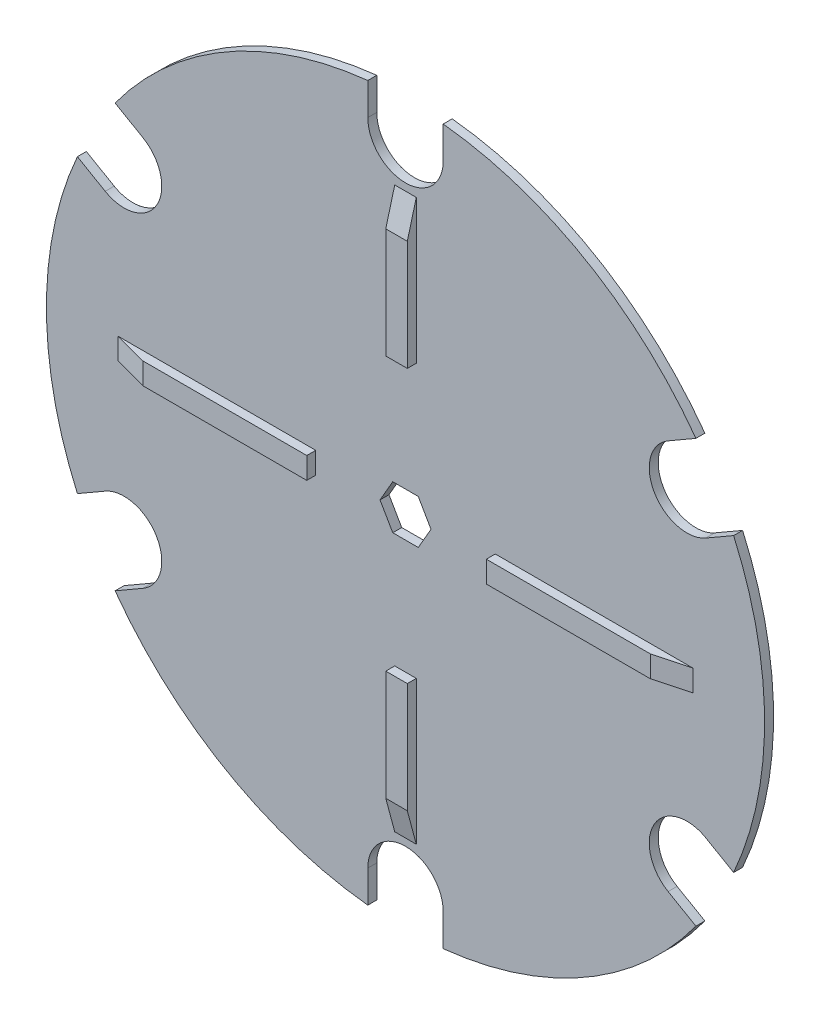
from build123d import *
from OCP.BRepFilletAPI import BRepFilletAPI_MakeChamfer

# Parameters (mm, degrees)
SKETCH1_R           = 100
BOSS_EXTRUDE1_DEPTH = 2.5
SKETCH8_W           = 1.221153846
SKETCH8_H           = 0.325641026
CUT_EXTRUDE6_DEPTH  = 0.2
CUT_EXTRUDE7_DEPTH  = 10
CUT_EXTRUDE8_DEPTH  = 10
BOSS_EXTRUDE2_DEPTH = 2.5
CHAMFER1_SIZE       = 2.5
CHAMFER1_SIZE_2     = 9.330127019


with BuildPart() as part:
    # Sketch1 → Boss-Extrude1 (new body)
    with BuildSketch(Plane.XY):
        Circle(SKETCH1_R)
    extrude(amount=BOSS_EXTRUDE1_DEPTH)

    # Sketch8 → Cut-Extrude6 (cut)
    # profile 1 of 12: a face of its own
    with BuildSketch(Plane(origin=(0, 0, 0), x_dir=(-1, 0, 0), z_dir=(0, 0, -1))):
        with BuildLine():
            add(Edge.make_bspline(
                [(-21.303796635, -42.5044388), (-21.303499075, -42.453550456), (-21.302921062, -42.354699113), (-21.296490852, -42.210658759), (-21.285808934, -42.075530497), (-21.271170032, -41.949307858), (-21.253355578, -41.831958258), (-21.229574387, -41.723795299), (-21.202529916, -41.62431837), (-21.171185911, -41.533203084), (-21.135818417, -41.449221882), (-21.09732448, -41.370821878), (-21.054176417, -41.298121696), (-21.008840217, -41.229960986), (-20.959480695, -41.167455492), (-20.907502507, -41.109722505), (-20.850876948, -41.058096324), (-20.791528933, -41.011064321), (-20.72892114, -40.969835158), (-20.66483815, -40.933519745), (-20.598838876, -40.902495579), (-20.530743124, -40.878102113), (-20.461162947, -40.857953702), (-20.389855107, -40.844175156), (-20.31670187, -40.835505675), (-20.267324783, -40.834676848), (-20.242283213, -40.834256508)],
                knots=[0, 0, 0, 0, 1.646270934, 3.197905019, 4.663502075, 6.030701355, 7.308322542, 8.50163776, 9.611534131, 10.641858119, 11.616356847, 12.558055219, 13.465016945, 14.349605745, 15.204443733, 16.039544428, 16.859896111, 17.680448484, 18.487036065, 19.28249412, 20.06191084, 20.843045899, 21.620316918, 22.403196591, 23.190181807, 24, 24, 24, 24], degree=3))
            add(Edge.make_bspline(
                [(-20.242283213, -40.834256508), (-20.217032458, -40.834699027), (-20.16681665, -40.835579056), (-20.092575738, -40.844037204), (-20.020049955, -40.858071722), (-19.949548501, -40.877957178), (-19.880492263, -40.902627542), (-19.813421379, -40.933549427), (-19.747919241, -40.969543828), (-19.685026766, -41.011838345), (-19.624053507, -41.058993695), (-19.566497141, -41.112299831), (-19.512352427, -41.171218505), (-19.460939829, -41.235119338), (-19.413717966, -41.305227951), (-19.368747781, -41.380324965), (-19.328496005, -41.461723678), (-19.28972955, -41.548065959), (-19.256267783, -41.64174085), (-19.226090547, -41.742220311), (-19.201707482, -41.850691181), (-19.181397214, -41.966584346), (-19.165662915, -42.09032542), (-19.154203304, -42.221649149), (-19.148149863, -42.360641932), (-19.147009855, -42.455672267), (-19.14642484, -42.5044388)],
                knots=[0, 0, 0, 0, 0.810914788, 1.612654377, 2.396697861, 3.181598691, 3.963628158, 4.749916497, 5.551656086, 6.361998678, 7.18212741, 8.025565596, 8.878627764, 9.750805457, 10.657531673, 11.591944965, 12.560506719, 13.57287815, 14.630710178, 15.753379473, 16.941251878, 18.199788006, 19.531962791, 20.947069417, 22.433333509, 24, 24, 24, 24], degree=3))
            add(Edge.make_bspline(
                [(-19.14642484, -42.5044388), (-19.14701592, -42.552992631), (-19.148167616, -42.64759779), (-19.154135443, -42.785965175), (-19.165890773, -42.916591971), (-19.180595548, -43.039791462), (-19.200961778, -43.155050874), (-19.226003608, -43.262769052), (-19.253807829, -43.363411174), (-19.288129392, -43.456152753), (-19.325694822, -43.54228753), (-19.366566322, -43.622721301), (-19.41035395, -43.698165009), (-19.458059454, -43.768014779), (-19.508907908, -43.832765418), (-19.563987616, -43.891273976), (-19.621745933, -43.944950228), (-19.682898624, -43.992712776), (-19.74677196, -44.034518277), (-19.812049122, -44.071905127), (-19.879888334, -44.102051929), (-19.948752227, -44.127937288), (-20.019625817, -44.147713412), (-20.092420757, -44.161387553), (-20.166766771, -44.170977729), (-20.217023905, -44.171709322), (-20.242283213, -44.172077021)],
                knots=[0, 0, 0, 0, 1.561518951, 3.042555995, 4.452378317, 5.7783523, 7.031515105, 8.214008947, 9.334062868, 10.386615937, 11.391082383, 12.354592575, 13.286541444, 14.194233754, 15.072674879, 15.931287219, 16.775624067, 17.606195743, 18.42308326, 19.229000347, 20.022332153, 20.807536673, 21.593273796, 22.3848459, 23.188221202, 24, 24, 24, 24], degree=3))
            add(Edge.make_bspline(
                [(-20.242283213, -44.172077021), (-20.267324088, -44.17165397), (-20.316699806, -44.170819796), (-20.389863077, -44.162189483), (-20.460876437, -44.148314276), (-20.530090306, -44.128886357), (-20.597859788, -44.105105755), (-20.663261419, -44.074123485), (-20.72702239, -44.038441865), (-20.788972587, -43.997806019), (-20.847947904, -43.951249921), (-20.904280211, -43.899756602), (-20.956554335, -43.842041078), (-21.005208122, -43.779014677), (-21.051448902, -43.711257236), (-21.093984262, -43.63784364), (-21.133327822, -43.559064986), (-21.169290132, -43.47441231), (-21.201174991, -43.38265034), (-21.229339697, -43.282729299), (-21.25157754, -43.173767258), (-21.270612078, -43.056639361), (-21.285964912, -42.930842295), (-21.296446335, -42.796307768), (-21.302924528, -42.653119614), (-21.303500628, -42.554903462), (-21.303796635, -42.5044388)],
                knots=[0, 0, 0, 0, 0.810891512, 1.598919785, 2.382837074, 3.152667961, 3.926044502, 4.706494248, 5.493654104, 6.291793342, 7.103789334, 7.925228297, 8.761435821, 9.622817696, 10.50288917, 11.416980706, 12.369136599, 13.353924996, 14.394355917, 15.514179734, 16.714354668, 17.994756427, 19.357759367, 20.818452758, 22.365282078, 24, 24, 24, 24], degree=3))
        make_face()
        with BuildLine():
            add(Edge.make_bspline(
                [(-21.018860737, -42.503166765), (-21.018752382, -42.545574513), (-21.018542085, -42.627879625), (-21.013048246, -42.747480298), (-21.005564107, -42.859031953), (-20.99591093, -42.962676233), (-20.981575398, -43.058062315), (-20.965512812, -43.145846242), (-20.945965617, -43.22556345), (-20.922837993, -43.297760964), (-20.896495384, -43.363664048), (-20.867733636, -43.424988007), (-20.836835695, -43.482457264), (-20.802256179, -43.535555608), (-20.764596086, -43.5844562), (-20.724706058, -43.630024555), (-20.681097357, -43.670661817), (-20.620768962, -43.71939975), (-20.541125017, -43.769763535), (-20.440776462, -43.813620345), (-20.337662938, -43.841181574), (-20.267675733, -43.844686552), (-20.232742949, -43.846435996)],
                knots=[0, 0, 0, 0, 1.459021318, 2.831673884, 4.118529203, 5.306027144, 6.411944654, 7.436330062, 8.375795394, 9.233974572, 10.042671642, 10.816086306, 11.563610507, 12.285937304, 12.993564865, 13.685989202, 14.367179055, 15.041617293, 16.353048772, 17.594441528, 18.799311195, 20, 20, 20, 20], degree=3))
            add(Edge.make_bspline(
                [(-20.232742949, -43.846435996), (-20.197584204, -43.84498658), (-20.127339304, -43.842090742), (-20.024710789, -43.814151887), (-19.925079044, -43.771997376), (-19.846999499, -43.722152139), (-19.787597477, -43.674682869), (-19.745037065, -43.63421101), (-19.705973635, -43.588893901), (-19.668924038, -43.53999954), (-19.634943305, -43.486593787), (-19.604043173, -43.42893345), (-19.575846137, -43.36685841), (-19.559781502, -43.323524433), (-19.551568069, -43.301368888)],
                knots=[0, 0, 0, 0, 1.353760809, 2.704726607, 4.075137775, 5.516104923, 6.260822281, 7.007110065, 7.778089737, 8.566572457, 9.372053459, 10.217411131, 11.088608312, 12, 12, 12, 12], degree=3))
            add(Edge.make_bspline(
                [(-19.551568069, -43.301368888), (-19.541996108, -43.273039053), (-19.522560923, -43.215517338), (-19.497513099, -43.126287454), (-19.477786916, -43.032667804), (-19.460040148, -42.935217877), (-19.447927019, -42.833219005), (-19.438177217, -42.726986785), (-19.432434379, -42.616441121), (-19.431722498, -42.541334236), (-19.431360737, -42.503166765)],
                knots=[0, 0, 0, 0, 0.884706709, 1.796334032, 2.740027952, 3.714592787, 4.726048262, 5.777819803, 6.87074269, 8, 8, 8, 8], degree=3))
            add(Edge.make_bspline(
                [(-19.431360737, -42.503166765), (-19.431859838, -42.465005467), (-19.432836184, -42.39035381), (-19.436568159, -42.281026604), (-19.446205259, -42.177187992), (-19.456908745, -42.078390635), (-19.47269051, -41.985181431), (-19.48970652, -41.896780083), (-19.51256762, -41.814281768), (-19.536987702, -41.736394861), (-19.564937132, -41.664004268), (-19.595703548, -41.596772476), (-19.628561858, -41.534374904), (-19.66425089, -41.47698275), (-19.702346974, -41.424338943), (-19.743855608, -41.377498989), (-19.787130289, -41.335011168), (-19.847743022, -41.286512981), (-19.927094699, -41.237063086), (-20.025833251, -41.191555575), (-20.128585906, -41.165422338), (-20.198048968, -41.161737808), (-20.232742949, -41.159897534)],
                knots=[0, 0, 0, 0, 1.31362396, 2.569729283, 3.763502607, 4.902122613, 5.988968491, 7.01645872, 7.998833611, 8.933434873, 9.825090667, 10.667526885, 11.477055099, 12.250526234, 12.991942729, 13.710640831, 14.402115721, 15.076753259, 16.378508321, 17.609869233, 18.806226677, 20, 20, 20, 20], degree=3))
            add(Edge.make_bspline(
                [(-20.232742949, -41.159897534), (-20.267858986, -41.161740346), (-20.338155033, -41.165429328), (-20.441975678, -41.191458208), (-20.541493197, -41.236827113), (-20.620635038, -41.286676765), (-20.681290045, -41.334155091), (-20.724000774, -41.375327088), (-20.764047658, -41.420363333), (-20.800939072, -41.469713642), (-20.835491493, -41.522750082), (-20.867224269, -41.57988989), (-20.895814989, -41.641422628), (-20.922198819, -41.707296108), (-20.945396991, -41.779487394), (-20.964532229, -41.859106409), (-20.98220977, -41.946611125), (-20.994724049, -42.042513822), (-21.005849028, -42.146184061), (-21.012998536, -42.2580142), (-21.018560463, -42.377815459), (-21.018758641, -42.460546124), (-21.018860737, -42.503166765)],
                knots=[0, 0, 0, 0, 1.207732386, 2.417664972, 3.655092373, 4.956220595, 5.625982001, 6.301752483, 6.994047911, 7.697131622, 8.419323945, 9.170223765, 9.943494443, 10.752040957, 11.610060368, 12.549350801, 13.567764191, 14.679664412, 15.874934091, 17.154273443, 18.533957287, 20, 20, 20, 20], degree=3))
        make_face(mode=Mode.SUBTRACT)
    # profile 2 of 12: a face of its own
    with BuildSketch(Plane(origin=(0, 0, 0), x_dir=(-1, 0, 0), z_dir=(0, 0, -1))):
        with BuildLine():
            Line((-18.45443766, -41.892589842), (-18.739373558, -41.892589842))
            add(Edge.make_bspline(
                [(-18.739373558, -41.892589842), (-18.737516498, -41.854788394), (-18.733869281, -41.780547355), (-18.716789333, -41.672303526), (-18.692350108, -41.56883953), (-18.657795718, -41.470986108), (-18.614882166, -41.377878047), (-18.563419927, -41.289885176), (-18.502465505, -41.207343169), (-18.433335111, -41.131017218), (-18.358252131, -41.060997065), (-18.277238886, -41.000531237), (-18.19210804, -40.949443064), (-18.103117871, -40.906733652), (-18.00926436, -40.874675363), (-17.911399196, -40.85088859), (-17.809092408, -40.836577191), (-17.73938753, -40.835038871), (-17.703936859, -40.834256508)],
                knots=[0, 0, 0, 0, 1.10065271, 2.161652631, 3.183658789, 4.190468796, 5.17591951, 6.163126047, 7.15150782, 8.156236427, 9.156009102, 10.134482811, 11.092018607, 12.041330605, 13.001268258, 13.972401359, 14.968799086, 16, 16, 16, 16], degree=3))
            add(Edge.make_bspline(
                [(-17.703936859, -40.834256508), (-17.669122463, -40.835071537), (-17.600713419, -40.836673038), (-17.500871449, -40.850426258), (-17.405823475, -40.871966902), (-17.315755287, -40.902188744), (-17.231385499, -40.942814617), (-17.152080309, -40.99161667), (-17.076895574, -41.048058946), (-17.009216563, -41.114510619), (-16.947069948, -41.185451354), (-16.893455759, -41.261186809), (-16.84754239, -41.33940909), (-16.809272137, -41.420714673), (-16.781099783, -41.505869105), (-16.75971098, -41.593632639), (-16.747621111, -41.684913718), (-16.74576562, -41.746696093), (-16.744822276, -41.778106669)],
                knots=[0, 0, 0, 0, 1.111607364, 2.184268762, 3.212621178, 4.221274766, 5.211760367, 6.196651075, 7.1921475, 8.207485113, 9.220403448, 10.201281604, 11.166441695, 12.114753415, 13.065576456, 14.026450734, 14.996634279, 16, 16, 16, 16], degree=3))
            add(Edge.make_bspline(
                [(-16.744822276, -41.778106669), (-16.746358307, -41.822327919), (-16.749403415, -41.909994398), (-16.775451456, -42.038822167), (-16.816133648, -42.163639054), (-16.865116965, -42.264093606), (-16.914531253, -42.345041133), (-16.959060635, -42.411687744), (-17.011189428, -42.483447704), (-17.071676351, -42.560080718), (-17.139270171, -42.642187039), (-17.214583134, -42.729717067), (-17.298152292, -42.821766459), (-17.356806789, -42.88463654), (-17.38720008, -42.917214241)],
                knots=[0, 0, 0, 0, 1.184426356, 2.348067706, 3.509069118, 4.696110526, 5.333549288, 6.050745305, 6.844228056, 7.710549037, 8.667450064, 9.695053472, 10.805634456, 12, 12, 12, 12], degree=3))
            Line((-17.38720008, -42.917214241), (-18.181586098, -43.765025739))
            Line((-18.181586098, -43.765025739), (-16.704117148, -43.765025739))
            Line((-16.704117148, -43.765025739), (-16.704117148, -44.090666765))
            Line((-16.704117148, -44.090666765), (-18.861488943, -44.090666765))
            Line((-18.861488943, -44.090666765), (-17.630158814, -42.776654345))
            add(Edge.make_bspline(
                [(-17.630158814, -42.776654345), (-17.60017966, -42.745359453), (-17.54259584, -42.685248369), (-17.461150216, -42.597488684), (-17.387999134, -42.516073029), (-17.322669071, -42.441155231), (-17.266577248, -42.371639452), (-17.216800295, -42.309777114), (-17.176917223, -42.252849863), (-17.133632542, -42.186863734), (-17.091709859, -42.106298275), (-17.055685079, -42.007842714), (-17.033718752, -41.906490135), (-17.031083652, -41.837999001), (-17.029758173, -41.803547374)],
                knots=[0, 0, 0, 0, 1.329631726, 2.553950428, 3.673215718, 4.687767853, 5.603093632, 6.413772471, 7.123043292, 7.734684054, 8.834405432, 9.900288307, 10.943827018, 12, 12, 12, 12], degree=3))
            add(Edge.make_bspline(
                [(-17.029758173, -41.803547374), (-17.030334882, -41.781883534), (-17.031471465, -41.739188265), (-17.041502377, -41.676590184), (-17.056661193, -41.616206389), (-17.078382963, -41.557851141), (-17.107054791, -41.502111157), (-17.141955643, -41.448918586), (-17.182223772, -41.397493596), (-17.228806709, -41.349275961), (-17.279980016, -41.305115153), (-17.334040514, -41.265995447), (-17.391235966, -41.233302825), (-17.451325219, -41.206502653), (-17.514140752, -41.185479271), (-17.579804057, -41.170911846), (-17.6481337, -41.161765592), (-17.694791229, -41.160528093), (-17.718565265, -41.159897534)],
                knots=[0, 0, 0, 0, 0.991446411, 1.95395049, 2.89581595, 3.838931463, 4.798493298, 5.75982156, 6.748411868, 7.785213223, 8.824556874, 9.840280684, 10.836137867, 11.835679398, 12.848801643, 13.863922112, 14.911575587, 16, 16, 16, 16], degree=3))
            add(Edge.make_bspline(
                [(-17.718565265, -41.159897534), (-17.74339452, -41.160546171), (-17.792155078, -41.161819985), (-17.863745915, -41.170730545), (-17.93204087, -41.186102843), (-17.997211739, -41.207127398), (-18.059368792, -41.23385051), (-18.118209747, -41.267135164), (-18.17360251, -41.306853047), (-18.225651214, -41.351884123), (-18.273606395, -41.402019733), (-18.315740346, -41.457908771), (-18.352555845, -41.518530783), (-18.384677078, -41.583722197), (-18.410762597, -41.654074554), (-18.430695384, -41.729338115), (-18.446467737, -41.809186083), (-18.451736895, -41.864326838), (-18.45443766, -41.892589842)],
                knots=[0, 0, 0, 0, 1.031018746, 2.02475058, 2.990194455, 3.934040569, 4.864654155, 5.795059489, 6.735614925, 7.690564532, 8.649604399, 9.611025574, 10.590972636, 11.591080095, 12.624614302, 13.701020113, 14.821632451, 16, 16, 16, 16], degree=3))
        make_face()
    # profile 3 of 12: a face of its own
    with BuildSketch(Plane(origin=(0, 0, 0), x_dir=(-1, 0, 0), z_dir=(0, 0, -1))):
        with Locations((-15.808604327, -42.869512919)):
            Rectangle(SKETCH8_W, SKETCH8_H)
    # profile 4 of 12: a face of its own
    with BuildSketch(Plane(origin=(0, 0, 0), x_dir=(-1, 0, 0), z_dir=(0, 0, -1))):
        with BuildLine():
            add(Edge.make_bspline(
                [(-14.953796635, -42.5044388), (-14.953499075, -42.453550456), (-14.952921062, -42.354699113), (-14.946490852, -42.210658759), (-14.935808934, -42.075530497), (-14.921170032, -41.949307858), (-14.903355578, -41.831958258), (-14.879574387, -41.723795299), (-14.852529916, -41.62431837), (-14.821185911, -41.533203084), (-14.785818417, -41.449221882), (-14.74732448, -41.370821878), (-14.704176417, -41.298121696), (-14.658840217, -41.229960986), (-14.609480695, -41.167455492), (-14.557502507, -41.109722505), (-14.500876948, -41.058096324), (-14.441528933, -41.011064321), (-14.37892114, -40.969835158), (-14.31483815, -40.933519745), (-14.248838876, -40.902495579), (-14.180743124, -40.878102113), (-14.111162947, -40.857953702), (-14.039855107, -40.844175156), (-13.96670187, -40.835505675), (-13.917324783, -40.834676848), (-13.892283213, -40.834256508)],
                knots=[0, 0, 0, 0, 1.646270934, 3.197905019, 4.663502075, 6.030701355, 7.308322542, 8.50163776, 9.611534131, 10.641858119, 11.616356847, 12.558055219, 13.465016945, 14.349605745, 15.204443733, 16.039544428, 16.859896111, 17.680448484, 18.487036065, 19.28249412, 20.06191084, 20.843045899, 21.620316918, 22.403196591, 23.190181807, 24, 24, 24, 24], degree=3))
            add(Edge.make_bspline(
                [(-13.892283213, -40.834256508), (-13.867032458, -40.834699027), (-13.81681665, -40.835579056), (-13.742575738, -40.844037204), (-13.670049955, -40.858071722), (-13.599548501, -40.877957178), (-13.530492263, -40.902627542), (-13.463421379, -40.933549427), (-13.397919241, -40.969543828), (-13.335026766, -41.011838345), (-13.274053507, -41.058993695), (-13.216497141, -41.112299831), (-13.162352427, -41.171218505), (-13.110939829, -41.235119338), (-13.063717966, -41.305227951), (-13.018747781, -41.380324965), (-12.978496005, -41.461723678), (-12.93972955, -41.548065959), (-12.906267783, -41.64174085), (-12.876090547, -41.742220311), (-12.851707482, -41.850691181), (-12.831397214, -41.966584346), (-12.815662915, -42.09032542), (-12.804203304, -42.221649149), (-12.798149863, -42.360641932), (-12.797009855, -42.455672267), (-12.79642484, -42.5044388)],
                knots=[0, 0, 0, 0, 0.810914788, 1.612654377, 2.396697861, 3.181598691, 3.963628158, 4.749916497, 5.551656086, 6.361998678, 7.18212741, 8.025565596, 8.878627764, 9.750805457, 10.657531673, 11.591944965, 12.560506719, 13.57287815, 14.630710178, 15.753379473, 16.941251878, 18.199788006, 19.531962791, 20.947069417, 22.433333509, 24, 24, 24, 24], degree=3))
            add(Edge.make_bspline(
                [(-12.79642484, -42.5044388), (-12.79701592, -42.552992631), (-12.798167616, -42.64759779), (-12.804135443, -42.785965175), (-12.815890773, -42.916591971), (-12.830595548, -43.039791462), (-12.850961778, -43.155050874), (-12.876003608, -43.262769052), (-12.903807829, -43.363411174), (-12.938129392, -43.456152753), (-12.975694822, -43.54228753), (-13.016566322, -43.622721301), (-13.06035395, -43.698165009), (-13.108059454, -43.768014779), (-13.158907908, -43.832765418), (-13.213987616, -43.891273976), (-13.271745933, -43.944950228), (-13.332898624, -43.992712776), (-13.39677196, -44.034518277), (-13.462049122, -44.071905127), (-13.529888334, -44.102051929), (-13.598752227, -44.127937288), (-13.669625817, -44.147713412), (-13.742420757, -44.161387553), (-13.816766771, -44.170977729), (-13.867023905, -44.171709322), (-13.892283213, -44.172077021)],
                knots=[0, 0, 0, 0, 1.561518951, 3.042555995, 4.452378317, 5.7783523, 7.031515105, 8.214008947, 9.334062868, 10.386615937, 11.391082383, 12.354592575, 13.286541444, 14.194233754, 15.072674879, 15.931287219, 16.775624067, 17.606195743, 18.42308326, 19.229000347, 20.022332153, 20.807536673, 21.593273796, 22.3848459, 23.188221202, 24, 24, 24, 24], degree=3))
            add(Edge.make_bspline(
                [(-13.892283213, -44.172077021), (-13.917324088, -44.17165397), (-13.966699806, -44.170819796), (-14.039863077, -44.162189483), (-14.110876437, -44.148314276), (-14.180090306, -44.128886357), (-14.247859788, -44.105105755), (-14.313261419, -44.074123485), (-14.37702239, -44.038441865), (-14.438972587, -43.997806019), (-14.497947904, -43.951249921), (-14.554280211, -43.899756602), (-14.606554335, -43.842041078), (-14.655208122, -43.779014677), (-14.701448902, -43.711257236), (-14.743984262, -43.63784364), (-14.783327822, -43.559064986), (-14.819290132, -43.47441231), (-14.851174991, -43.38265034), (-14.879339697, -43.282729299), (-14.90157754, -43.173767258), (-14.920612078, -43.056639361), (-14.935964912, -42.930842295), (-14.946446335, -42.796307768), (-14.952924528, -42.653119614), (-14.953500628, -42.554903462), (-14.953796635, -42.5044388)],
                knots=[0, 0, 0, 0, 0.810891512, 1.598919785, 2.382837074, 3.152667961, 3.926044502, 4.706494248, 5.493654104, 6.291793342, 7.103789334, 7.925228297, 8.761435821, 9.622817696, 10.50288917, 11.416980706, 12.369136599, 13.353924996, 14.394355917, 15.514179734, 16.714354668, 17.994756427, 19.357759367, 20.818452758, 22.365282078, 24, 24, 24, 24], degree=3))
        make_face()
        with BuildLine():
            add(Edge.make_bspline(
                [(-14.668860737, -42.503166765), (-14.668752382, -42.545574513), (-14.668542085, -42.627879625), (-14.663048246, -42.747480298), (-14.655564107, -42.859031953), (-14.64591093, -42.962676233), (-14.631575398, -43.058062315), (-14.615512812, -43.145846242), (-14.595965617, -43.22556345), (-14.572837993, -43.297760964), (-14.546495384, -43.363664048), (-14.517733636, -43.424988007), (-14.486835695, -43.482457264), (-14.452256179, -43.535555608), (-14.414596086, -43.5844562), (-14.374706058, -43.630024555), (-14.331097357, -43.670661817), (-14.270768962, -43.71939975), (-14.191125017, -43.769763535), (-14.090776462, -43.813620345), (-13.987662938, -43.841181574), (-13.917675733, -43.844686552), (-13.882742949, -43.846435996)],
                knots=[0, 0, 0, 0, 1.459021318, 2.831673884, 4.118529203, 5.306027144, 6.411944654, 7.436330062, 8.375795394, 9.233974572, 10.042671642, 10.816086306, 11.563610507, 12.285937304, 12.993564865, 13.685989202, 14.367179055, 15.041617293, 16.353048772, 17.594441528, 18.799311195, 20, 20, 20, 20], degree=3))
            add(Edge.make_bspline(
                [(-13.882742949, -43.846435996), (-13.847584204, -43.84498658), (-13.777339304, -43.842090742), (-13.674710789, -43.814151887), (-13.575079044, -43.771997376), (-13.496999499, -43.722152139), (-13.437597477, -43.674682869), (-13.395037065, -43.63421101), (-13.355973635, -43.588893901), (-13.318924038, -43.53999954), (-13.284943305, -43.486593787), (-13.254043173, -43.42893345), (-13.225846137, -43.36685841), (-13.209781502, -43.323524433), (-13.201568069, -43.301368888)],
                knots=[0, 0, 0, 0, 1.353760809, 2.704726607, 4.075137775, 5.516104923, 6.260822281, 7.007110065, 7.778089737, 8.566572457, 9.372053459, 10.217411131, 11.088608312, 12, 12, 12, 12], degree=3))
            add(Edge.make_bspline(
                [(-13.201568069, -43.301368888), (-13.191996108, -43.273039053), (-13.172560923, -43.215517338), (-13.147513099, -43.126287454), (-13.127786916, -43.032667804), (-13.110040148, -42.935217877), (-13.097927019, -42.833219005), (-13.088177217, -42.726986785), (-13.082434379, -42.616441121), (-13.081722498, -42.541334236), (-13.081360737, -42.503166765)],
                knots=[0, 0, 0, 0, 0.884706709, 1.796334032, 2.740027952, 3.714592787, 4.726048262, 5.777819803, 6.87074269, 8, 8, 8, 8], degree=3))
            add(Edge.make_bspline(
                [(-13.081360737, -42.503166765), (-13.081859838, -42.465005467), (-13.082836184, -42.39035381), (-13.086568159, -42.281026604), (-13.096205259, -42.177187992), (-13.106908745, -42.078390635), (-13.12269051, -41.985181431), (-13.13970652, -41.896780083), (-13.16256762, -41.814281768), (-13.186987702, -41.736394861), (-13.214937132, -41.664004268), (-13.245703548, -41.596772476), (-13.278561858, -41.534374904), (-13.31425089, -41.47698275), (-13.352346974, -41.424338943), (-13.393855608, -41.377498989), (-13.437130289, -41.335011168), (-13.497743022, -41.286512981), (-13.577094699, -41.237063086), (-13.675833251, -41.191555575), (-13.778585906, -41.165422338), (-13.848048968, -41.161737808), (-13.882742949, -41.159897534)],
                knots=[0, 0, 0, 0, 1.31362396, 2.569729283, 3.763502607, 4.902122613, 5.988968491, 7.01645872, 7.998833611, 8.933434873, 9.825090667, 10.667526885, 11.477055099, 12.250526234, 12.991942729, 13.710640831, 14.402115721, 15.076753259, 16.378508321, 17.609869233, 18.806226677, 20, 20, 20, 20], degree=3))
            add(Edge.make_bspline(
                [(-13.882742949, -41.159897534), (-13.917858986, -41.161740346), (-13.988155033, -41.165429328), (-14.091975678, -41.191458208), (-14.191493197, -41.236827113), (-14.270635038, -41.286676765), (-14.331290045, -41.334155091), (-14.374000774, -41.375327088), (-14.414047658, -41.420363333), (-14.450939072, -41.469713642), (-14.485491493, -41.522750082), (-14.517224269, -41.57988989), (-14.545814989, -41.641422628), (-14.572198819, -41.707296108), (-14.595396991, -41.779487394), (-14.614532229, -41.859106409), (-14.63220977, -41.946611125), (-14.644724049, -42.042513822), (-14.655849028, -42.146184061), (-14.662998536, -42.2580142), (-14.668560463, -42.377815459), (-14.668758641, -42.460546124), (-14.668860737, -42.503166765)],
                knots=[0, 0, 0, 0, 1.207732386, 2.417664972, 3.655092373, 4.956220595, 5.625982001, 6.301752483, 6.994047911, 7.697131622, 8.419323945, 9.170223765, 9.943494443, 10.752040957, 11.610060368, 12.549350801, 13.567764191, 14.679664412, 15.874934091, 17.154273443, 18.533957287, 20, 20, 20, 20], degree=3))
        make_face(mode=Mode.SUBTRACT)
    # profile 5 of 12: a face of its own
    with BuildSketch(Plane(origin=(0, 0, 0), x_dir=(-1, 0, 0), z_dir=(0, 0, -1))):
        Polygon((-10.778340906, -40.834256508), (-10.720463301, -40.834256508), (-10.720463301, -43.032333432), (-10.354117148, -43.032333432), (-10.354117148, -43.357974457), (-10.720463301, -43.357974457), (-10.720463301, -44.090666765), (-11.005399199, -44.090666765), (-11.005399199, -43.357974457), (-12.511488943, -43.357974457), align=None)
        Polygon((-11.005399199, -43.032333432), (-11.005399199, -41.653447214), (-11.95179343, -43.032333432), align=None, mode=Mode.SUBTRACT)
    # profile 6 of 12: a face of its own
    with BuildSketch(Plane(origin=(0, 0, 0), x_dir=(-1, 0, 0), z_dir=(0, 0, -1))):
        with Locations((-9.458604327, -42.869512919)):
            Rectangle(SKETCH8_W, SKETCH8_H)
    # profile 7 of 12: a face of its own
    with BuildSketch(Plane(origin=(0, 0, 0), x_dir=(-1, 0, 0), z_dir=(0, 0, -1))):
        Polygon((-7.928981931, -40.915666765), (-7.34193766, -40.915666765), (-7.34193766, -44.090666765), (-7.626873558, -44.090666765), (-7.626873558, -41.241307791), (-8.115335096, -41.241307791), align=None)
    # profile 8 of 12: a face of its own
    with BuildSketch(Plane(origin=(0, 0, 0), x_dir=(-1, 0, 0), z_dir=(0, 0, -1))):
        Polygon((-4.428340906, -40.834256508), (-4.370463301, -40.834256508), (-4.370463301, -43.032333432), (-4.004117148, -43.032333432), (-4.004117148, -43.357974457), (-4.370463301, -43.357974457), (-4.370463301, -44.090666765), (-4.655399199, -44.090666765), (-4.655399199, -43.357974457), (-6.161488943, -43.357974457), align=None)
        Polygon((-4.655399199, -43.032333432), (-4.655399199, -41.653447214), (-5.60179343, -43.032333432), align=None, mode=Mode.SUBTRACT)
    # profile 9 of 12: a face of its own
    with BuildSketch(Plane(origin=(0, 0, 0), x_dir=(-1, 0, 0), z_dir=(0, 0, -1))):
        Polygon((-3.044366547, -40.915666765), (-2.457322276, -40.915666765), (-2.457322276, -44.090666765), (-2.742258173, -44.090666765), (-2.742258173, -41.241307791), (-3.230719712, -41.241307791), align=None)
    # profile 10 of 12: a face of its own
    with BuildSketch(Plane(origin=(0, 0, 0), x_dir=(-1, 0, 0), z_dir=(0, 0, -1))):
        Polygon((-0.602058854, -40.915666765), (-0.015014584, -40.915666765), (-0.015014584, -44.090666765), (-0.299950481, -44.090666765), (-0.299950481, -41.241307791), (-0.788412019, -41.241307791), align=None)
    # profile 11 of 12: a face of its own
    with BuildSketch(Plane(origin=(0, 0, 0), x_dir=(-1, 0, 0), z_dir=(0, 0, -1))):
        Polygon((1.840248838, -40.915666765), (2.427293109, -40.915666765), (2.427293109, -44.090666765), (2.142357211, -44.090666765), (2.142357211, -41.241307791), (1.653895673, -41.241307791), align=None)
    # profile 12 of 12: a face of its own
    with BuildSketch(Plane(origin=(0, 0, 0), x_dir=(-1, 0, 0), z_dir=(0, 0, -1))):
        with BuildLine():
            add(Edge.make_bspline(
                [(5.15135661, -42.321901741), (5.177344935, -42.335452601), (5.228030848, -42.361881304), (5.300218744, -42.404436126), (5.36619071, -42.449286144), (5.427777148, -42.494312959), (5.483896045, -42.541240957), (5.533919905, -42.590256749), (5.579084389, -42.640136857), (5.618478685, -42.691725926), (5.653128673, -42.7448869), (5.683075396, -42.799759312), (5.70867243, -42.856222908), (5.72895881, -42.914894032), (5.745670007, -42.974910841), (5.757168591, -43.037048296), (5.763352509, -43.100896948), (5.764521647, -43.144048193), (5.765113622, -43.165897133)],
                knots=[0, 0, 0, 0, 1.272397273, 2.481599622, 3.635517121, 4.734568067, 5.792894095, 6.808321871, 7.773003508, 8.711915296, 9.623354172, 10.525449501, 11.423591555, 12.311487226, 13.218079475, 14.126165749, 15.051214107, 16, 16, 16, 16], degree=3))
            add(Edge.make_bspline(
                [(5.765113622, -43.165897133), (5.764413833, -43.196465791), (5.763028689, -43.256972634), (5.750963703, -43.346277321), (5.732899787, -43.433010866), (5.706520515, -43.517154254), (5.672309082, -43.598243185), (5.630147952, -43.676347073), (5.582422073, -43.752746017), (5.544093256, -43.799753618), (5.524698958, -43.823539361)],
                knots=[0, 0, 0, 0, 1.025265484, 2.029385089, 3.018602448, 3.995076438, 4.983346944, 5.966715145, 6.97116228, 8, 8, 8, 8], degree=3))
            add(Edge.make_bspline(
                [(5.524698958, -43.823539361), (5.499447299, -43.851292285), (5.449256023, -43.906455182), (5.363274368, -43.978074845), (5.268911659, -44.038263224), (5.166533028, -44.087314157), (5.056412144, -44.125492043), (4.938572468, -44.152926327), (4.812784272, -44.168640245), (4.726328595, -44.170911722), (4.681975601, -44.172077021)],
                knots=[0, 0, 0, 0, 0.954267603, 1.896743057, 2.838368354, 3.796610408, 4.779680527, 5.799409237, 6.871065594, 8, 8, 8, 8], degree=3))
            add(Edge.make_bspline(
                [(4.681975601, -44.172077021), (4.639327741, -44.171031559), (4.556339338, -44.168997196), (4.435546121, -44.155213676), (4.322948764, -44.131058397), (4.217892579, -44.09799793), (4.121010907, -44.05499008), (4.032579808, -44.001461023), (3.951323419, -43.939565358), (3.879707689, -43.867525444), (3.816127458, -43.790365803), (3.760276439, -43.710762557), (3.713854239, -43.62870844), (3.674550374, -43.545426949), (3.644462239, -43.459750795), (3.623623162, -43.372120783), (3.61038857, -43.282689975), (3.608627684, -43.222336261), (3.607741827, -43.191973856)],
                knots=[0, 0, 0, 0, 1.256902934, 2.445805442, 3.576955095, 4.645999104, 5.686449165, 6.692658513, 7.68621702, 8.689161843, 9.678783111, 10.630372946, 11.551080876, 12.453998257, 13.34127905, 14.221779781, 15.105423033, 16, 16, 16, 16], degree=3))
            add(Edge.make_bspline(
                [(3.607741827, -43.191973856), (3.608266047, -43.169695161), (3.609302092, -43.125664595), (3.616472919, -43.06061399), (3.628001309, -42.997298924), (3.643658102, -42.935485536), (3.664877104, -42.875623838), (3.690496754, -42.817430194), (3.720370739, -42.760838905), (3.754915796, -42.705540491), (3.795104061, -42.652309791), (3.840609657, -42.600243424), (3.892342081, -42.550149302), (3.949725814, -42.501415388), (4.012105075, -42.453177183), (4.081100121, -42.408041629), (4.154881921, -42.362813333), (4.207319682, -42.335772923), (4.234219191, -42.321901741)],
                knots=[0, 0, 0, 0, 0.941657376, 1.861047343, 2.762797495, 3.66048619, 4.553285746, 5.444104102, 6.34607688, 7.256116206, 8.197091036, 9.162375105, 10.176350973, 11.237807142, 12.343728897, 13.50695164, 14.721116704, 16, 16, 16, 16], degree=3))
            add(Edge.make_bspline(
                [(4.234219191, -42.321901741), (4.197397015, -42.301822344), (4.126098976, -42.26294301), (4.031693126, -42.191508408), (3.950603061, -42.114140176), (3.88505771, -42.029204576), (3.833466474, -41.939354912), (3.798071026, -41.84515334), (3.774125644, -41.74834658), (3.771753622, -41.682210244), (3.77056234, -41.64899509)],
                knots=[0, 0, 0, 0, 1.166880483, 2.259407225, 3.286803203, 4.280235371, 5.237608625, 6.161067461, 7.076446754, 8, 8, 8, 8], degree=3))
            add(Edge.make_bspline(
                [(3.77056234, -41.64899509), (3.772045903, -41.615160877), (3.775028124, -41.547148206), (3.799142993, -41.445905509), (3.838440482, -41.346467625), (3.891890244, -41.249316514), (3.958462933, -41.157740248), (4.038333728, -41.075606675), (4.12959529, -41.00365983), (4.231792069, -40.943265731), (4.341770654, -40.894113412), (4.45780849, -40.860205842), (4.577883809, -40.838038794), (4.659615311, -40.835529043), (4.70105613, -40.834256508)],
                knots=[0, 0, 0, 0, 0.888701115, 1.786444228, 2.72001202, 3.692817113, 4.693886446, 5.687152267, 6.695133018, 7.739871481, 8.800368666, 9.853104506, 10.91144658, 12, 12, 12, 12], degree=3))
            add(Edge.make_bspline(
                [(4.70105613, -40.834256508), (4.741427447, -40.835568548), (4.821035087, -40.838155741), (4.938051642, -40.859733838), (5.050015638, -40.895774188), (5.156540969, -40.944666669), (5.255720592, -41.004889108), (5.343352687, -41.077824187), (5.420761529, -41.159595451), (5.484791658, -41.251143948), (5.537553708, -41.347921752), (5.574293811, -41.449179325), (5.597835959, -41.552728828), (5.600805368, -41.622794732), (5.602293109, -41.657899337)],
                knots=[0, 0, 0, 0, 1.072916533, 2.115669174, 3.151510826, 4.193348718, 5.225979165, 6.227137561, 7.216255879, 8.211077061, 9.189680878, 10.138522389, 11.067357538, 12, 12, 12, 12], degree=3))
            add(Edge.make_bspline(
                [(5.602293109, -41.657899337), (5.600991757, -41.692349596), (5.598435977, -41.760007948), (5.576936746, -41.858638434), (5.540729669, -41.951005569), (5.491295678, -42.038157462), (5.426865415, -42.118513535), (5.348298921, -42.193095618), (5.25622258, -42.262516384), (5.187043062, -42.301692586), (5.15135661, -42.321901741)],
                knots=[0, 0, 0, 0, 0.975232327, 1.915300861, 2.843280834, 3.77672583, 4.742871857, 5.749627742, 6.839139064, 8, 8, 8, 8], degree=3))
        make_face()
        with BuildLine():
            add(Edge.make_bspline(
                [(4.685155689, -41.159897534), (4.662884601, -41.160488484), (4.619312614, -41.16164464), (4.555423748, -41.167684975), (4.494670244, -41.179435393), (4.436417339, -41.195073367), (4.381463702, -41.216198899), (4.329062999, -41.241050086), (4.280107048, -41.271263445), (4.234004866, -41.305155389), (4.192502378, -41.342432525), (4.155668249, -41.381270685), (4.125072031, -41.422432647), (4.099090453, -41.464894516), (4.080238648, -41.509916539), (4.066119601, -41.556118392), (4.056575196, -41.604083919), (4.055860013, -41.636864897), (4.055498237, -41.653447214)],
                knots=[0, 0, 0, 0, 1.203892937, 2.355340988, 3.463153438, 4.544400666, 5.610487187, 6.640501085, 7.674077295, 8.714426146, 9.728707835, 10.68524104, 11.601827946, 12.495867327, 13.368432065, 14.231010473, 15.105153427, 16, 16, 16, 16], degree=3))
            add(Edge.make_bspline(
                [(4.055498237, -41.653447214), (4.056121777, -41.670030247), (4.057353982, -41.702800704), (4.066883633, -41.751193025), (4.081086637, -41.798746939), (4.103448309, -41.844331694), (4.13026922, -41.889528598), (4.163372201, -41.933208058), (4.202822962, -41.975522086), (4.247297855, -42.016110779), (4.29574975, -42.054118943), (4.34707956, -42.087114614), (4.400643073, -42.1147227), (4.45588995, -42.137700089), (4.513383256, -42.155561675), (4.572770699, -42.168233233), (4.634062262, -42.176109044), (4.675591789, -42.177049771), (4.696604006, -42.177525739)],
                knots=[0, 0, 0, 0, 0.873023192, 1.725219244, 2.590779336, 3.480155217, 4.391973325, 5.357036234, 6.360879153, 7.436073238, 8.526419356, 9.601555421, 10.645666583, 11.697338044, 12.750135903, 13.812665442, 14.89329948, 16, 16, 16, 16], degree=3))
            add(Edge.make_bspline(
                [(4.696604006, -42.177525739), (4.7235916, -42.176733924), (4.777300234, -42.175158114), (4.856475056, -42.160506692), (4.933457598, -42.137459896), (5.007425033, -42.105927641), (5.076462763, -42.066350939), (5.138003397, -42.01896813), (5.191522007, -41.964873299), (5.236462417, -41.904908584), (5.271305635, -41.841089643), (5.298430847, -41.777045091), (5.314270663, -41.712091639), (5.316336742, -41.66857875), (5.317357211, -41.647087037)],
                knots=[0, 0, 0, 0, 1.076279235, 2.141928126, 3.20205304, 4.278698113, 5.344010996, 6.36967002, 7.368914609, 8.37248503, 9.349703398, 10.264243087, 11.142681841, 12, 12, 12, 12], degree=3))
            add(Edge.make_bspline(
                [(5.317357211, -41.647087037), (5.316874704, -41.632003033), (5.315916997, -41.602063447), (5.308024803, -41.557850787), (5.294983869, -41.514643951), (5.277328075, -41.472086005), (5.254096333, -41.430774056), (5.226551677, -41.390058683), (5.193092165, -41.350855811), (5.155539686, -41.31225185), (5.112953494, -41.276524914), (5.065415659, -41.245106284), (5.0131699, -41.218425075), (4.956214981, -41.196754561), (4.894760657, -41.180478287), (4.829089978, -41.1682896), (4.758655372, -41.161419706), (4.710186955, -41.160415929), (4.685155689, -41.159897534)],
                knots=[0, 0, 0, 0, 0.814439003, 1.616544685, 2.417341072, 3.248991801, 4.09997495, 4.973547432, 5.9003056, 6.880240646, 7.880314356, 8.896779544, 9.951930927, 11.043077905, 12.18215768, 13.381699519, 14.647792085, 16, 16, 16, 16], degree=3))
        make_face(mode=Mode.SUBTRACT)
        with BuildLine():
            add(Edge.make_bspline(
                [(4.7036002, -42.503166765), (4.675364666, -42.503668997), (4.619973438, -42.504654253), (4.538823224, -42.515621157), (4.460942139, -42.530887821), (4.386592768, -42.554047938), (4.315806508, -42.584161897), (4.248200161, -42.62038823), (4.184290922, -42.663210311), (4.124961306, -42.712084098), (4.070783714, -42.764752317), (4.02325097, -42.820507253), (3.982885363, -42.878312694), (3.950379485, -42.938902788), (3.923698842, -43.000994549), (3.906178397, -43.066134296), (3.894946415, -43.133069749), (3.893438171, -43.178572124), (3.892677724, -43.201514121)],
                knots=[0, 0, 0, 0, 1.140299081, 2.23698856, 3.303958914, 4.344563908, 5.37730929, 6.408454204, 7.439741482, 8.480804886, 9.510774543, 10.48932336, 11.43758569, 12.353841022, 13.263987381, 14.161954604, 15.073269652, 16, 16, 16, 16], degree=3))
            add(Edge.make_bspline(
                [(3.892677724, -43.201514121), (3.893914395, -43.230026443), (3.89636792, -43.286594223), (3.915832157, -43.370199295), (3.947070107, -43.451135538), (3.990635838, -43.528743381), (4.044581422, -43.601269548), (4.110917575, -43.664487223), (4.185521764, -43.72065885), (4.270918245, -43.766089049), (4.364198354, -43.802370096), (4.465337279, -43.82736729), (4.572883527, -43.843914891), (4.647141871, -43.845582384), (4.685155689, -43.846435996)],
                knots=[0, 0, 0, 0, 0.898778495, 1.783155532, 2.693654817, 3.627872908, 4.583023416, 5.533784346, 6.509005473, 7.520592997, 8.575161974, 9.658835044, 10.801527049, 12, 12, 12, 12], degree=3))
            add(Edge.make_bspline(
                [(4.685155689, -43.846435996), (4.714864951, -43.845865577), (4.772748121, -43.844754217), (4.857190375, -43.834944108), (4.93687793, -43.819386948), (5.011656254, -43.796759589), (5.082362452, -43.76913711), (5.147797708, -43.733602436), (5.209645372, -43.693187114), (5.264857827, -43.645237215), (5.315143666, -43.594002245), (5.358988867, -43.539764134), (5.39705036, -43.483996954), (5.426923441, -43.425440443), (5.450805114, -43.365218027), (5.467971482, -43.302774385), (5.478563477, -43.237917995), (5.479634718, -43.193922409), (5.480177724, -43.171621292)],
                knots=[0, 0, 0, 0, 1.224942928, 2.386581632, 3.501229538, 4.569074225, 5.605009692, 6.626002462, 7.634866581, 8.645888296, 9.63523824, 10.59253846, 11.518950513, 12.414518923, 13.29783783, 14.186679152, 15.080837789, 16, 16, 16, 16], degree=3))
            add(Edge.make_bspline(
                [(5.480177724, -43.171621292), (5.47935599, -43.149961133), (5.477735674, -43.107251083), (5.467451676, -43.043962877), (5.44938513, -42.982818896), (5.424595277, -42.923083533), (5.391592547, -42.865967142), (5.352726129, -42.809981758), (5.305832178, -42.756681269), (5.252843609, -42.705651675), (5.195095837, -42.658465971), (5.13371207, -42.616724301), (5.069164808, -42.581570596), (5.001590638, -42.552980632), (4.931139606, -42.530494856), (4.857863528, -42.514786775), (4.781676614, -42.504899278), (4.729919695, -42.503750794), (4.7036002, -42.503166765)],
                knots=[0, 0, 0, 0, 0.917430815, 1.809013306, 2.70690318, 3.612392954, 4.541220862, 5.495268465, 6.494511384, 7.542276156, 8.608045339, 9.649016899, 10.681629292, 11.715607085, 12.752076957, 13.808767841, 14.885711793, 16, 16, 16, 16], degree=3))
        make_face(mode=Mode.SUBTRACT)
    extrude(amount=-CUT_EXTRUDE6_DEPTH, mode=Mode.SUBTRACT)

    # Sketch9 → Cut-Extrude7 (cut)
    with BuildSketch(Plane.XY.offset(2.5)):
        Polygon((-7.101408311, 0), (-3.550704156, -6.15), (3.550704156, -6.15), (7.101408311, 0), (3.550704156, 6.15), (-3.550704156, 6.15), align=None)
    extrude(amount=-CUT_EXTRUDE7_DEPTH, mode=Mode.SUBTRACT)

    # Sketch10 → Cut-Extrude8 (cut)
    with BuildSketch(Plane.XY.offset(2.5)):
        with BuildLine():
            Line((-10.5, -90.5), (-10.5, -99.447222183))
            Line((-10.5, -99.447222183), (-10.5, -107.410103096))
            Line((-10.5, -107.410103096), (10.5, -107.410103096))
            Line((10.5, -107.410103096), (10.5, -99.447222183))
            Line((10.5, -99.447222183), (10.5, -90.5))
            ThreePointArc((10.5, -90.5), (0, -80), (-10.5, -90.5))
        make_face()
        with BuildLine():
            Line((-83.625299042, -36.15673326), (-91.373820747, -40.630344352))
            Line((-91.373820747, -40.630344352), (-98.269877904, -44.611784808))
            Line((-98.269877904, -44.611784808), (-87.769877904, -62.798318288))
            Line((-87.769877904, -62.798318288), (-80.873820747, -58.816877831))
            Line((-80.873820747, -58.816877831), (-73.125299042, -54.34326674))
            ThreePointArc((-73.125299042, -54.34326674), (-69.282032303, -40), (-83.625299042, -36.15673326))
        make_face()
        with BuildLine():
            Line((-73.125299042, 54.34326674), (-80.873820747, 58.816877831))
            Line((-80.873820747, 58.816877831), (-87.769877904, 62.798318288))
            Line((-87.769877904, 62.798318288), (-98.269877904, 44.611784808))
            Line((-98.269877904, 44.611784808), (-91.373820747, 40.630344352))
            Line((-91.373820747, 40.630344352), (-83.625299042, 36.15673326))
            ThreePointArc((-83.625299042, 36.15673326), (-69.282032303, 40), (-73.125299042, 54.34326674))
        make_face()
        with BuildLine():
            Line((10.5, 90.5), (10.5, 99.447222183))
            Line((10.5, 99.447222183), (10.5, 107.410103096))
            Line((10.5, 107.410103096), (-10.5, 107.410103096))
            Line((-10.5, 107.410103096), (-10.5, 99.447222183))
            Line((-10.5, 99.447222183), (-10.5, 90.5))
            ThreePointArc((-10.5, 90.5), (0, 80), (10.5, 90.5))
        make_face()
        with BuildLine():
            Line((83.625299042, 36.15673326), (91.373820747, 40.630344352))
            Line((91.373820747, 40.630344352), (98.269877904, 44.611784808))
            Line((98.269877904, 44.611784808), (87.769877904, 62.798318288))
            Line((87.769877904, 62.798318288), (80.873820747, 58.816877831))
            Line((80.873820747, 58.816877831), (73.125299042, 54.34326674))
            ThreePointArc((73.125299042, 54.34326674), (69.282032303, 40), (83.625299042, 36.15673326))
        make_face()
        with BuildLine():
            Line((73.125299042, -54.34326674), (80.873820747, -58.816877831))
            Line((80.873820747, -58.816877831), (87.769877904, -62.798318288))
            Line((87.769877904, -62.798318288), (98.269877904, -44.611784808))
            Line((98.269877904, -44.611784808), (91.373820747, -40.630344352))
            Line((91.373820747, -40.630344352), (83.625299042, -36.15673326))
            ThreePointArc((83.625299042, -36.15673326), (69.282032303, -40), (73.125299042, -54.34326674))
        make_face()
    extrude(amount=-CUT_EXTRUDE8_DEPTH, mode=Mode.SUBTRACT)

    # Sketch11 → Boss-Extrude2 (add)
    with BuildSketch(Plane.XY.offset(2.5)):
        Polygon((-80, 0), (-80, 3), (-25, 3), (-25, -3), (-80, -3), align=None)
        Polygon((0, 78), (-3, 78), (-3, 38), (3, 38), (3, 78), align=None)
        Polygon((25, 3), (80, 3), (80, 0), (80, -3), (25, -3), align=None)
        Polygon((3, -38), (-3, -38), (-3, -78), (0, -78), (3, -78), align=None)
    extrude(amount=BOSS_EXTRUDE2_DEPTH)

    # Chamfer1
    chamfer1_edges_1 = [part.edges().sort_by_distance(p)[0] for p in [
        (80, 0, 5),
    ]]
    chamfer1_side_1 = [part.faces().sort_by_distance(p)[0] for p in [
        (80, 0, 4.95),
    ]]
    chamfer1_edges_2 = [part.edges().sort_by_distance(p)[0] for p in [
        (0, 78, 5),
    ]]
    chamfer1_side_2 = [part.faces().sort_by_distance(p)[0] for p in [
        (0, 78, 4.95),
    ]]
    chamfer1_edges_3 = [part.edges().sort_by_distance(p)[0] for p in [
        (0, -78, 5),
    ]]
    chamfer1_side_3 = [part.faces().sort_by_distance(p)[0] for p in [
        (0, -78, 4.95),
    ]]
    chamfer1_edges_4 = [part.edges().sort_by_distance(p)[0] for p in [
        (-80, 0, 5),
    ]]
    chamfer1_side_4 = [part.faces().sort_by_distance(p)[0] for p in [
        (-80, 0, 4.95),
    ]]
    chamfer1 = BRepFilletAPI_MakeChamfer(part.part.solid().wrapped)
    for e in chamfer1_edges_1:
        chamfer1.Add(CHAMFER1_SIZE - 0.0001, CHAMFER1_SIZE_2 - 0.0001, e.wrapped, chamfer1_side_1[0].wrapped)
    for e in chamfer1_edges_2:
        chamfer1.Add(CHAMFER1_SIZE - 0.0001, CHAMFER1_SIZE_2 - 0.0001, e.wrapped, chamfer1_side_2[0].wrapped)
    for e in chamfer1_edges_3:
        chamfer1.Add(CHAMFER1_SIZE - 0.0001, CHAMFER1_SIZE_2 - 0.0001, e.wrapped, chamfer1_side_3[0].wrapped)
    for e in chamfer1_edges_4:
        chamfer1.Add(CHAMFER1_SIZE - 0.0001, CHAMFER1_SIZE_2 - 0.0001, e.wrapped, chamfer1_side_4[0].wrapped)
    add(Compound.cast(chamfer1.Shape()), mode=Mode.REPLACE)  # a hair under: the kernel refuses the full size


solid = part.part
